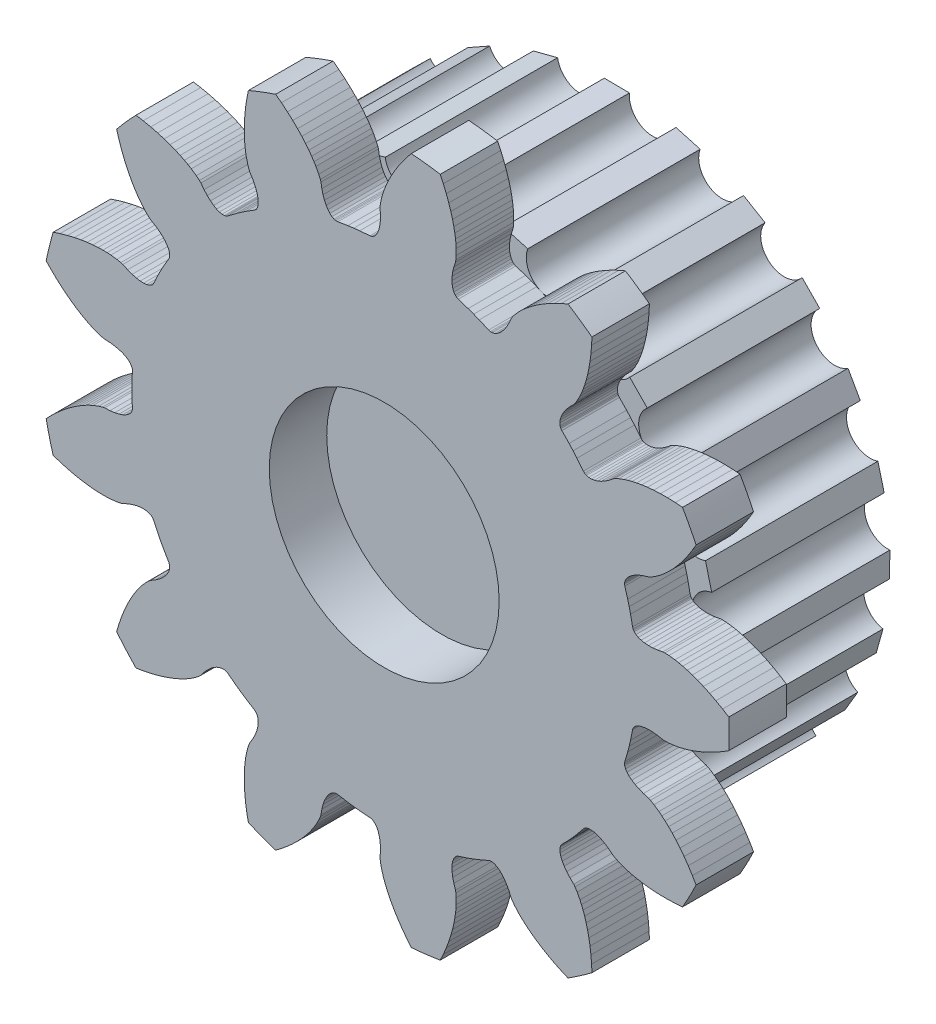
from build123d import *

# Parameters (mm, degrees)
MODEL_R             = 0.75
BOSS_EXTRUDE2_DEPTH = 5
SKETCH3_R           = 10
CUT_EXTRUDE1_DEPTH  = 5
BOSS_EXTRUDE3_DEPTH = 15


with BuildPart() as part:
    # Model → Boss-Extrude2 (new body)
    with BuildSketch(Plane.XY):
        with BuildLine():
            Line((55.1190207, -17.6838158), (54.9037463, -18.318159))
            Line((54.9037463, -18.318159), (54.724323631, -18.92713208))
            ThreePointArc((54.724323631, -18.92713208), (55.544759511, -19.893607211), (56.405295338, -20.824556888))
            Line((56.405295338, -20.824556888), (57.0314552, -20.719846))
            Line((57.0314552, -20.719846), (57.6871218, -20.5826028))
            Line((57.6871218, -20.5826028), (58.2944208, -20.4286814))
            Line((58.2944208, -20.4286814), (58.8525218, -20.2621016))
            Line((58.8525218, -20.2621016), (59.3647711, -20.0855498))
            Line((59.3647711, -20.0855498), (59.8292544, -19.9033306))
            Line((59.8292544, -19.9033306), (60.2448825, -19.7198564))
            Line((60.2448825, -19.7198564), (60.6155171, -19.5373309))
            Line((60.6155171, -19.5373309), (60.9397625, -19.3604166))
            Line((60.9397625, -19.3604166), (61.2189808, -19.1925447))
            Line((61.2189808, -19.1925447), (61.6494891, -18.8966781))
            Line((61.6494891, -18.8966781), (61.9241145, -18.6724392))
            Line((61.9241145, -18.6724392), (62.0542121, -18.5453089))
            Line((62.0542121, -18.5453089), (62.333578, -18.1781789))
            Line((62.333578, -18.1781789), (62.6138773, -17.866433))
            Line((62.6138773, -17.866433), (62.8909988, -17.6094085))
            Line((62.8909988, -17.6094085), (63.1608873, -17.4062382))
            Line((63.1608873, -17.4062382), (63.4195308, -17.2557811))
            Line((63.4195308, -17.2557811), (63.6630345, -17.1566733))
            Line((63.6630345, -17.1566733), (63.887594, -17.1072973))
            Line((63.887594, -17.1072973), (64.0894991, -17.1058455))
            Line((64.0894991, -17.1058455), (64.180835, -17.1224493))
            Line((64.180835, -17.1224493), (64.2651801, -17.1502548))
            Line((64.2651801, -17.1502548), (64.3946808, -17.2249523))
            Line((64.3946808, -17.2249523), (65.1083043, -17.7654177))
            Line((65.1083043, -17.7654177), (65.5309788, -18.0644959))
            Line((65.5309788, -18.0644959), (65.9605041, -18.3536488))
            Line((65.9605041, -18.3536488), (66.7189025, -18.8292467))
            Line((66.7189025, -18.8292467), (66.8346674, -18.9238439))
            Line((66.8346674, -18.9238439), (66.8905752, -18.9928479))
            Line((66.8905752, -18.9928479), (66.9384882, -19.0723607))
            Line((66.9384882, -19.0723607), (67.0087273, -19.2616601))
            Line((67.0087273, -19.2616601), (67.0421898, -19.4891358))
            Line((67.0421898, -19.4891358), (67.03587, -19.7519599))
            Line((67.03587, -19.7519599), (66.9869064, -20.0471485))
            Line((66.9869064, -20.0471485), (66.8926427, -20.3715438))
            Line((66.8926427, -20.3715438), (66.7505892, -20.7217991))
            Line((66.7505892, -20.7217991), (66.5584973, -21.0944301))
            Line((66.5584973, -21.0944301), (66.3142893, -21.4858279))
            Line((66.3142893, -21.4858279), (66.2415537, -21.6525523))
            Line((66.2415537, -21.6525523), (66.1292701, -21.9888476))
            Line((66.1292701, -21.9888476), (66.0052904, -22.4962956))
            Line((66.0052904, -22.4962956), (65.9473396, -22.8168975))
            Line((65.9473396, -22.8168975), (65.8969008, -23.1828069))
            Line((65.8969008, -23.1828069), (65.8576654, -23.5940807))
            Line((65.8576654, -23.5940807), (65.8334978, -24.0477606))
            Line((65.8334978, -24.0477606), (65.827828, -24.5466758))
            Line((65.827828, -24.5466758), (65.8443953, -25.0882433))
            Line((65.8443953, -25.0882433), (65.8865458, -25.6691468))
            Line((65.8865458, -25.6691468), (65.957978, -26.2915626))
            Line((65.957978, -26.2915626), (66.0621559, -26.9532886))
            Line((66.0621559, -26.9532886), (66.186288926, -27.575889293))
            ThreePointArc((66.186288926, -27.575889293), (67.36189219, -28.050384933), (68.55649269, -28.474788973))
            Line((68.55649269, -28.474788973), (69.0622682, -28.0910811))
            Line((69.0622682, -28.0910811), (69.579052, -27.6648548))
            Line((69.579052, -27.6648548), (70.0452578, -27.2463383))
            Line((70.0452578, -27.2463383), (70.4620182, -26.8394767))
            Line((70.4620182, -26.8394767), (70.8335447, -26.4450938))
            Line((70.8335447, -26.4450938), (71.1601427, -26.0678906))
            Line((71.1601427, -26.0678906), (71.4428984, -25.7122802))
            Line((71.4428984, -25.7122802), (71.6862553, -25.3784194))
            Line((71.6862553, -25.3784194), (71.8911442, -25.0710852))
            Line((71.8911442, -25.0710852), (72.0603657, -24.7926828))
            Line((72.0603657, -24.7926828), (72.3040658, -24.3306388))
            Line((72.3040658, -24.3306388), (72.4430254, -24.0044603))
            Line((72.4430254, -24.0044603), (72.4991408, -23.8314327))
            Line((72.4991408, -23.8314327), (72.5758931, -23.3765274))
            Line((72.5758931, -23.3765274), (72.6792104, -22.9702285))
            Line((72.6792104, -22.9702285), (72.8051441, -22.6138598))
            Line((72.8051441, -22.6138598), (72.9497005, -22.308538))
            Line((72.9497005, -22.308538), (73.108797, -22.0551173))
            Line((73.108797, -22.0551173), (73.2783512, -21.8541998))
            Line((73.2783512, -21.8541998), (73.4542425, -21.7061215))
            Line((73.4542425, -21.7061215), (73.632346, -21.611006))
            Line((73.632346, -21.611006), (73.720936, -21.5832621))
            Line((73.720936, -21.5832621), (73.8085418, -21.5686855))
            Line((73.8085418, -21.5686855), (73.9579226, -21.5746449))
            Line((73.9579226, -21.5746449), (74.8409717, -21.7215659))
            Line((74.8409717, -21.7215659), (75.3542199, -21.7899598))
            Line((75.3542199, -21.7899598), (75.8689217, -21.8463816))
            Line((75.8689217, -21.8463816), (76.7614715, -21.9150573))
            Line((76.7614715, -21.9150573), (76.9079377, -21.9450203))
            Line((76.9079377, -21.9450203), (76.9895094, -21.9801388))
            Line((76.9895094, -21.9801388), (77.0688857, -22.0282775))
            Line((77.0688857, -22.0282775), (77.2190512, -22.1632521))
            Line((77.2190512, -22.1632521), (77.3543939, -22.349121))
            Line((77.3543939, -22.349121), (77.4709385, -22.5847771))
            Line((77.4709385, -22.5847771), (77.5647644, -22.8689082))
            Line((77.5647644, -22.8689082), (77.632052, -23.1999525))
            Line((77.632052, -23.1999525), (77.6690417, -23.5761037))
            Line((77.6690417, -23.5761037), (77.672123, -23.9953217))
            Line((77.672123, -23.9953217), (77.6377791, -24.4553763))
            Line((77.6377791, -24.4553763), (77.6508556, -24.6368053))
            Line((77.6508556, -24.6368053), (77.7077177, -24.9867609))
            Line((77.7077177, -24.9867609), (77.833762, -25.4937))
            Line((77.833762, -25.4937), (77.9314402, -25.80451))
            Line((77.9314402, -25.80451), (78.0568255, -26.1519467))
            Line((78.0568255, -26.1519467), (78.2132127, -26.5343452))
            Line((78.2132127, -26.5343452), (78.4026489, -26.94729))
            Line((78.4026489, -26.94729), (78.629486, -27.3916924))
            Line((78.629486, -27.3916924), (78.8958345, -27.8635274))
            Line((78.8958345, -27.8635274), (79.2031163, -28.3583036))
            Line((79.2031163, -28.3583036), (79.5556174, -28.8762292))
            Line((79.5556174, -28.8762292), (79.9553818, -29.4137445))
            Line((79.9553818, -29.4137445), (80.354633081, -29.907342608))
            ThreePointArc((80.354633081, -29.907342608), (81.61608725, -29.781157591), (82.871083911, -29.601790205))
            Line((82.871083911, -29.601790205), (83.1406078, -29.0269881))
            Line((83.1406078, -29.0269881), (83.40012, -28.4094221))
            Line((83.40012, -28.4094221), (83.6184303, -27.8221874))
            Line((83.6184303, -27.8221874), (83.7983753, -27.2682512))
            Line((83.7983753, -27.2682512), (83.9440668, -26.7463855))
            Line((83.9440668, -26.7463855), (84.05796, -26.260611))
            Line((84.05796, -26.260611), (84.1430673, -25.8143305))
            Line((84.1430673, -25.8143305), (84.2033963, -25.4056179))
            Line((84.2033963, -25.4056179), (84.2419911, -25.0382703))
            Line((84.2419911, -25.0382703), (84.2624492, -24.713116))
            Line((84.2624492, -24.713116), (84.2635124, -24.1907433))
            Line((84.2635124, -24.1907433), (84.2349723, -23.8373488))
            Line((84.2349723, -23.8373488), (84.20425, -23.6580624))
            Line((84.20425, -23.6580624), (84.0608059, -23.2195952))
            Line((84.0608059, -23.2195952), (83.9634722, -22.8118215))
            Line((83.9634722, -22.8118215), (83.9093682, -22.4377484))
            Line((83.9093682, -22.4377484), (83.8954764, -22.1002206))
            Line((83.8954764, -22.1002206), (83.9185789, -21.8018918))
            Line((83.9185789, -21.8018918), (83.9753407, -21.5451926))
            Line((83.9753407, -21.5451926), (84.0622693, -21.332335))
            Line((84.0622693, -21.332335), (84.1757697, -21.1653456))
            Line((84.1757697, -21.1653456), (84.2413191, -21.0996097))
            Line((84.2413191, -21.0996097), (84.312116, -21.0459903))
            Line((84.312116, -21.0459903), (84.4471556, -20.9818463))
            Line((84.4471556, -20.9818463), (85.2973343, -20.7015651))
            Line((85.2973343, -20.7015651), (85.7835773, -20.5236065))
            Line((85.7835773, -20.5236065), (86.2655437, -20.3343717))
            Line((86.2655437, -20.3343717), (87.0877724, -19.9803925))
            Line((87.0877724, -19.9803925), (87.2313864, -19.9388571))
            Line((87.2313864, -19.9388571), (87.3199348, -19.9320447))
            Line((87.3199348, -19.9320447), (87.4125902, -19.9377815))
            Line((87.4125902, -19.9377815), (87.608281, -19.9875101))
            Line((87.608281, -19.9875101), (87.8144987, -20.089192))
            Line((87.8144987, -20.089192), (88.0272086, -20.2436941))
            Line((88.0272086, -20.2436941), (88.2423296, -20.4516767))
            Line((88.2423296, -20.4516767), (88.4557537, -20.7135317))
            Line((88.4557537, -20.7135317), (88.6633127, -21.0294071))
            Line((88.6633127, -21.0294071), (88.8608613, -21.3991742))
            Line((88.8608613, -21.3991742), (89.0442494, -21.8224928))
            Line((89.0442494, -21.8224928), (89.1401423, -21.9770632))
            Line((89.1401423, -21.9770632), (89.3531237, -22.2605083))
            Line((89.3531237, -22.2605083), (89.7003167, -22.6508049))
            Line((89.7003167, -22.6508049), (89.931247, -22.8806202))
            Line((89.931247, -22.8806202), (90.2037321, -23.1299907))
            Line((90.2037321, -23.1299907), (90.5199155, -23.395911))
            Line((90.5199155, -23.395911), (90.879558, -23.6735201))
            Line((90.879558, -23.6735201), (91.2869364, -23.9616024))
            Line((91.2869364, -23.9616024), (91.7420489, -24.2556132))
            Line((91.7420489, -24.2556132), (92.2440674, -24.5509148))
            Line((92.2440674, -24.5509148), (92.7968836, -24.8456997))
            Line((92.7968836, -24.8456997), (93.4006533, -25.1358661))
            Line((93.4006533, -25.1358661), (93.983559225, -25.387384246))
            ThreePointArc((93.983559225, -25.387384246), (95.041880291, -24.689425939), (96.069768437, -23.947377938))
            Line((96.069768437, -23.947377938), (96.0412962, -23.3131619))
            Line((96.0412962, -23.3131619), (95.9840855, -22.6457331))
            Line((95.9840855, -22.6457331), (95.9044882, -22.0243087))
            Line((95.9044882, -22.0243087), (95.8063946, -21.4501979))
            Line((95.8063946, -21.4501979), (95.6928749, -20.9204026))
            Line((95.6928749, -20.9204026), (95.5679716, -20.4373418))
            Line((95.5679716, -20.4373418), (95.4359335, -20.0026287))
            Line((95.4359335, -20.0026287), (95.2994139, -19.6126955))
            Line((95.2994139, -19.6126955), (95.162873, -19.2694895))
            Line((95.162873, -19.2694895), (95.0298811, -18.9720723))
            Line((95.0298811, -18.9720723), (94.7880637, -18.5090401))
            Line((94.7880637, -18.5090401), (94.5985622, -18.209388))
            Line((94.5985622, -18.209388), (94.4880404, -18.0649152))
            Line((94.4880404, -18.0649152), (94.157261, -17.7433335))
            Line((94.157261, -17.7433335), (93.8815744, -17.4275011))
            Line((93.8815744, -17.4275011), (93.6598272, -17.1214192))
            Line((93.6598272, -17.1214192), (93.4906698, -16.829009))
            Line((93.4906698, -16.829009), (93.3724857, -16.5541158))
            Line((93.3724857, -16.5541158), (93.3034516, -16.3004413))
            Line((93.3034516, -16.3004413), (93.2815032, -16.0715675))
            Line((93.2815032, -16.0715675), (93.304399, -15.8709595))
            Line((93.304399, -15.8709595), (93.3318911, -15.7822909))
            Line((93.3318911, -15.7822909), (93.3696606, -15.7019124))
            Line((93.3696606, -15.7019124), (93.459423, -15.5823596))
            Line((93.459423, -15.5823596), (94.0819656, -14.9390852))
            Line((94.0819656, -14.9390852), (94.4298109, -14.5555423))
            Line((94.4298109, -14.5555423), (94.7686292, -14.1640023))
            Line((94.7686292, -14.1640023), (95.3321742, -13.4684605))
            Line((95.3321742, -13.4684605), (95.4400356, -13.364942))
            Line((95.4400356, -13.364942), (95.5152755, -13.3177594))
            Line((95.5152755, -13.3177594), (95.5999838, -13.2797799))
            Line((95.5999838, -13.2797799), (95.7963694, -13.2328705))
            Line((95.7963694, -13.2328705), (96.02622, -13.2270712))
            Line((96.02622, -13.2270712), (96.286366, -13.2650248))
            Line((96.286366, -13.2650248), (96.5735005, -13.3492125))
            Line((96.5735005, -13.3492125), (96.8841683, -13.4818904))
            Line((96.8841683, -13.4818904), (97.2147472, -13.6651268))
            Line((97.2147472, -13.6651268), (97.5615072, -13.9007338))
            Line((97.5615072, -13.9007338), (97.9206152, -14.1903391))
            Line((97.9206152, -14.1903391), (98.0773567, -14.2826408))
            Line((98.0773567, -14.2826408), (98.3976658, -14.4346416))
            Line((98.3976658, -14.4346416), (98.8864698, -14.6188834))
            Line((98.8864698, -14.6188834), (99.1977489, -14.7150561))
            Line((99.1977489, -14.7150561), (99.5549107, -14.8092325))
            Line((99.5549107, -14.8092325), (99.9584566, -14.8977555))
            Line((99.9584566, -14.8977555), (100.4059156, -14.976432))
            Line((100.4059156, -14.976432), (100.9005097, -15.042198))
            Line((100.9005097, -15.042198), (101.4401255, -15.0910303))
            Line((101.4401255, -15.0910303), (102.0218743, -15.1192073))
            Line((102.0218743, -15.1192073), (102.6483621, -15.1233198))
            Line((102.6483621, -15.1233198), (103.3178207, -15.0996637))
            Line((103.3178207, -15.0996637), (103.950844382, -15.051482004))
            ThreePointArc((103.950844382, -15.051482004), (104.563583797, -13.941644289), (105.128886697, -12.80690997))
            Line((105.128886697, -12.80690997), (104.808941, -12.2585713))
            Line((104.808941, -12.2585713), (104.4481138, -11.6941795))
            Line((104.4481138, -11.6941795), (104.0888436, -11.1809263))
            Line((104.0888436, -11.1809263), (103.7351834, -10.7181628))
            Line((103.7351834, -10.7181628), (103.3884585, -10.3018076))
            Line((103.3884585, -10.3018076), (103.0533726, -9.932124))
            Line((103.0533726, -9.932124), (102.7344375, -9.6085658))
            Line((102.7344375, -9.6085658), (102.4323443, -9.3267409))
            Line((102.4323443, -9.3267409), (102.1519476, -9.0863008))
            Line((102.1519476, -9.0863008), (101.8959724, -8.8847554))
            Line((101.8959724, -8.8847554), (101.466672, -8.5871388))
            Line((101.466672, -8.5871388), (101.1596215, -8.4098759))
            Line((101.1596215, -8.4098759), (100.9946194, -8.3333136))
            Line((100.9946194, -8.3333136), (100.5522823, -8.202288))
            Line((100.5522823, -8.202288), (100.1613994, -8.0507502))
            Line((100.1613994, -8.0507502), (99.8228086, -7.8827792))
            Line((99.8228086, -7.8827792), (99.5371373, -7.7024742))
            Line((99.5371373, -7.7024742), (99.3047413, -7.5139912))
            Line((99.3047413, -7.5139912), (99.1257262, -7.3214554))
            Line((99.1257262, -7.3214554), (98.999929, -7.1289977))
            Line((98.999929, -7.1289977), (98.926975, -6.9407279))
            Line((98.926975, -6.9407279), (98.9101117, -6.8494395))
            Line((98.9101117, -6.8494395), (98.9062011, -6.7607155))
            Line((98.9062011, -6.7607155), (98.9301228, -6.6131421))
            Line((98.9301228, -6.6131421), (99.1824124, -5.7542409))
            Line((99.1824124, -5.7542409), (99.3121729, -5.2529788))
            Line((99.3121729, -5.2529788), (99.4302238, -4.7488306))
            Line((99.4302238, -4.7488306), (99.6059838, -3.8710665))
            Line((99.6059838, -3.8710665), (99.6533829, -3.7292798))
            Line((99.6533829, -3.7292798), (99.6980776, -3.6525359))
            Line((99.6980776, -3.6525359), (99.7554331, -3.5795409))
            Line((99.7554331, -3.5795409), (99.907524, -3.4467397))
            Line((99.907524, -3.4467397), (100.1083516, -3.3347877))
            Line((100.1083516, -3.3347877), (100.3563374, -3.2474981))
            Line((100.3563374, -3.2474981), (100.6497063, -3.1886046))
            Line((100.6497063, -3.1886046), (100.9864475, -3.1617105))
            Line((100.9864475, -3.1617105), (101.3643148, -3.1703306))
            Line((101.3643148, -3.1703306), (101.7808476, -3.2178028))
            Line((101.7808476, -3.2178028), (102.2334082, -3.3073498))
            Line((102.2334082, -3.3073498), (102.4150906, -3.3162375))
            Line((102.4150906, -3.3162375), (102.7693485, -3.3019724))
            Line((102.7693485, -3.3019724), (103.2877844, -3.2379519))
            Line((103.2877844, -3.2379519), (103.608102, -3.1784499))
            Line((103.608102, -3.1784499), (103.9681191, -3.0958577))
            Line((103.9681191, -3.0958577), (104.3665799, -2.9867038))
            Line((104.3665799, -2.9867038), (104.7993479, -2.8484238))
            Line((104.7993479, -2.8484238), (105.2678523, -2.6768073))
            Line((105.2678523, -2.6768073), (105.7683518, -2.4692742))
            Line((105.7683518, -2.4692742), (106.2965593, -2.2238715))
            Line((106.2965593, -2.2238715), (106.8531979, -1.9363696))
            Line((106.8531979, -1.9363696), (107.4349805, -1.6043102))
            Line((107.4349805, -1.6043102), (107.973104111, -1.267466597))
            ThreePointArc((107.973104111, -1.267466597), (107.9998906, 4.8e-08), (107.973104115, 1.267466692))
            Line((107.973104115, 1.267466692), (107.4349805, 1.6043102))
            Line((107.4349805, 1.6043102), (106.8531979, 1.9363696))
            Line((106.8531979, 1.9363696), (106.2965593, 2.2238715))
            Line((106.2965593, 2.2238715), (105.7683518, 2.4692742))
            Line((105.7683518, 2.4692742), (105.2678523, 2.6768073))
            Line((105.2678523, 2.6768073), (104.7993479, 2.8484238))
            Line((104.7993479, 2.8484238), (104.3665799, 2.9867038))
            Line((104.3665799, 2.9867038), (103.9681191, 3.0958577))
            Line((103.9681191, 3.0958577), (103.608102, 3.1784499))
            Line((103.608102, 3.1784499), (103.2877844, 3.2379519))
            Line((103.2877844, 3.2379519), (102.7693485, 3.3019724))
            Line((102.7693485, 3.3019724), (102.4150906, 3.3162375))
            Line((102.4150906, 3.3162375), (102.2334082, 3.3073498))
            Line((102.2334082, 3.3073498), (101.7808476, 3.2178028))
            Line((101.7808476, 3.2178028), (101.3643148, 3.1703306))
            Line((101.3643148, 3.1703306), (100.9864475, 3.1617105))
            Line((100.9864475, 3.1617105), (100.6497063, 3.1886046))
            Line((100.6497063, 3.1886046), (100.3563374, 3.2474981))
            Line((100.3563374, 3.2474981), (100.1083516, 3.3347877))
            Line((100.1083516, 3.3347877), (99.907524, 3.4467397))
            Line((99.907524, 3.4467397), (99.7554331, 3.5795409))
            Line((99.7554331, 3.5795409), (99.6980776, 3.6525359))
            Line((99.6980776, 3.6525359), (99.6533829, 3.7292798))
            Line((99.6533829, 3.7292798), (99.6059838, 3.8710665))
            Line((99.6059838, 3.8710665), (99.4302238, 4.7488306))
            Line((99.4302238, 4.7488306), (99.3121729, 5.2529788))
            Line((99.3121729, 5.2529788), (99.1824124, 5.7542409))
            Line((99.1824124, 5.7542409), (98.9301228, 6.6131421))
            Line((98.9301228, 6.6131421), (98.9062011, 6.7607155))
            Line((98.9062011, 6.7607155), (98.9101117, 6.8494395))
            Line((98.9101117, 6.8494395), (98.926975, 6.9407279))
            Line((98.926975, 6.9407279), (98.999929, 7.1289977))
            Line((98.999929, 7.1289977), (99.1257262, 7.3214554))
            Line((99.1257262, 7.3214554), (99.3047413, 7.5139912))
            Line((99.3047413, 7.5139912), (99.5371373, 7.7024742))
            Line((99.5371373, 7.7024742), (99.8228086, 7.8827792))
            Line((99.8228086, 7.8827792), (100.1613994, 8.0507502))
            Line((100.1613994, 8.0507502), (100.5522823, 8.202288))
            Line((100.5522823, 8.202288), (100.9946194, 8.3333136))
            Line((100.9946194, 8.3333136), (101.1596215, 8.4098759))
            Line((101.1596215, 8.4098759), (101.466672, 8.5871388))
            Line((101.466672, 8.5871388), (101.8959724, 8.8847554))
            Line((101.8959724, 8.8847554), (102.1519476, 9.0863008))
            Line((102.1519476, 9.0863008), (102.4323443, 9.3267409))
            Line((102.4323443, 9.3267409), (102.7344375, 9.6085658))
            Line((102.7344375, 9.6085658), (103.0533726, 9.932124))
            Line((103.0533726, 9.932124), (103.3884585, 10.3018076))
            Line((103.3884585, 10.3018076), (103.7351834, 10.7181628))
            Line((103.7351834, 10.7181628), (104.0888436, 11.1809263))
            Line((104.0888436, 11.1809263), (104.4481138, 11.6941795))
            Line((104.4481138, 11.6941795), (104.808941, 12.2585713))
            Line((104.808941, 12.2585713), (105.128886797, 12.80690997))
            ThreePointArc((105.128886797, 12.80690997), (104.563583897, 13.941644289), (103.950844482, 15.051482004))
            Line((103.950844482, 15.051482004), (103.3178207, 15.0996637))
            Line((103.3178207, 15.0996637), (102.6483621, 15.1233198))
            Line((102.6483621, 15.1233198), (102.0218743, 15.1192073))
            Line((102.0218743, 15.1192073), (101.4401255, 15.0910303))
            Line((101.4401255, 15.0910303), (100.9005097, 15.042198))
            Line((100.9005097, 15.042198), (100.4059156, 14.976432))
            Line((100.4059156, 14.976432), (99.9584566, 14.8977555))
            Line((99.9584566, 14.8977555), (99.5549107, 14.8092325))
            Line((99.5549107, 14.8092325), (99.1977489, 14.7150561))
            Line((99.1977489, 14.7150561), (98.8864698, 14.6188834))
            Line((98.8864698, 14.6188834), (98.3976658, 14.4346416))
            Line((98.3976658, 14.4346416), (98.0773567, 14.2826408))
            Line((98.0773567, 14.2826408), (97.9206152, 14.1903391))
            Line((97.9206152, 14.1903391), (97.5615072, 13.9007338))
            Line((97.5615072, 13.9007338), (97.2147472, 13.6651268))
            Line((97.2147472, 13.6651268), (96.8841683, 13.4818904))
            Line((96.8841683, 13.4818904), (96.5735005, 13.3492125))
            Line((96.5735005, 13.3492125), (96.286366, 13.2650248))
            Line((96.286366, 13.2650248), (96.02622, 13.2270712))
            Line((96.02622, 13.2270712), (95.7963694, 13.2328705))
            Line((95.7963694, 13.2328705), (95.5999838, 13.2797799))
            Line((95.5999838, 13.2797799), (95.5152755, 13.3177594))
            Line((95.5152755, 13.3177594), (95.4400356, 13.364942))
            Line((95.4400356, 13.364942), (95.3321742, 13.4684605))
            Line((95.3321742, 13.4684605), (94.7686292, 14.1640023))
            Line((94.7686292, 14.1640023), (94.4298109, 14.5555423))
            Line((94.4298109, 14.5555423), (94.0819656, 14.9390852))
            Line((94.0819656, 14.9390852), (93.459423, 15.5823596))
            Line((93.459423, 15.5823596), (93.3696606, 15.7019124))
            Line((93.3696606, 15.7019124), (93.3318911, 15.7822909))
            Line((93.3318911, 15.7822909), (93.304399, 15.8709595))
            Line((93.304399, 15.8709595), (93.2815032, 16.0715675))
            Line((93.2815032, 16.0715675), (93.3034516, 16.3004413))
            Line((93.3034516, 16.3004413), (93.3724857, 16.5541158))
            Line((93.3724857, 16.5541158), (93.4906698, 16.829009))
            Line((93.4906698, 16.829009), (93.6598272, 17.1214192))
            Line((93.6598272, 17.1214192), (93.8815744, 17.4275011))
            Line((93.8815744, 17.4275011), (94.157261, 17.7433335))
            Line((94.157261, 17.7433335), (94.4880404, 18.0649152))
            Line((94.4880404, 18.0649152), (94.5985622, 18.209388))
            Line((94.5985622, 18.209388), (94.7880637, 18.5090401))
            Line((94.7880637, 18.5090401), (95.0298811, 18.9720723))
            Line((95.0298811, 18.9720723), (95.162873, 19.2694895))
            Line((95.162873, 19.2694895), (95.2994139, 19.6126955))
            Line((95.2994139, 19.6126955), (95.4359335, 20.0026287))
            Line((95.4359335, 20.0026287), (95.5679716, 20.4373418))
            Line((95.5679716, 20.4373418), (95.6928749, 20.9204026))
            Line((95.6928749, 20.9204026), (95.8063946, 21.4501979))
            Line((95.8063946, 21.4501979), (95.9044882, 22.0243087))
            Line((95.9044882, 22.0243087), (95.9840855, 22.6457331))
            Line((95.9840855, 22.6457331), (96.0412962, 23.3131619))
            Line((96.0412962, 23.3131619), (96.069768437, 23.947377938))
            ThreePointArc((96.069768437, 23.947377938), (95.041880291, 24.689425939), (93.983559225, 25.387384246))
            Line((93.983559225, 25.387384246), (93.4006533, 25.1358661))
            Line((93.4006533, 25.1358661), (92.7968836, 24.8456997))
            Line((92.7968836, 24.8456997), (92.2440674, 24.5509148))
            Line((92.2440674, 24.5509148), (91.7420489, 24.2556132))
            Line((91.7420489, 24.2556132), (91.2869364, 23.9616024))
            Line((91.2869364, 23.9616024), (90.879558, 23.6735201))
            Line((90.879558, 23.6735201), (90.5199155, 23.395911))
            Line((90.5199155, 23.395911), (90.2037321, 23.1299907))
            Line((90.2037321, 23.1299907), (89.931247, 22.8806202))
            Line((89.931247, 22.8806202), (89.7003167, 22.6508049))
            Line((89.7003167, 22.6508049), (89.3531237, 22.2605083))
            Line((89.3531237, 22.2605083), (89.1401423, 21.9770632))
            Line((89.1401423, 21.9770632), (89.0442494, 21.8224928))
            Line((89.0442494, 21.8224928), (88.8608613, 21.3991742))
            Line((88.8608613, 21.3991742), (88.6633127, 21.0294071))
            Line((88.6633127, 21.0294071), (88.4557537, 20.7135317))
            Line((88.4557537, 20.7135317), (88.2423296, 20.4516767))
            Line((88.2423296, 20.4516767), (88.0272086, 20.2436941))
            Line((88.0272086, 20.2436941), (87.8144987, 20.089192))
            Line((87.8144987, 20.089192), (87.608281, 19.9875101))
            Line((87.608281, 19.9875101), (87.4125902, 19.9377815))
            Line((87.4125902, 19.9377815), (87.3199348, 19.9320447))
            Line((87.3199348, 19.9320447), (87.2313864, 19.9388571))
            Line((87.2313864, 19.9388571), (87.0877724, 19.9803925))
            Line((87.0877724, 19.9803925), (86.2655437, 20.3343717))
            Line((86.2655437, 20.3343717), (85.7835773, 20.5236065))
            Line((85.7835773, 20.5236065), (85.2973343, 20.7015651))
            Line((85.2973343, 20.7015651), (84.4471556, 20.9818463))
            Line((84.4471556, 20.9818463), (84.312116, 21.0459903))
            Line((84.312116, 21.0459903), (84.2413191, 21.0996097))
            Line((84.2413191, 21.0996097), (84.1757697, 21.1653456))
            Line((84.1757697, 21.1653456), (84.0622693, 21.332335))
            Line((84.0622693, 21.332335), (83.9753407, 21.5451926))
            Line((83.9753407, 21.5451926), (83.9185789, 21.8018918))
            Line((83.9185789, 21.8018918), (83.8954764, 22.1002206))
            Line((83.8954764, 22.1002206), (83.9093682, 22.4377484))
            Line((83.9093682, 22.4377484), (83.9634722, 22.8118215))
            Line((83.9634722, 22.8118215), (84.0608059, 23.2195952))
            Line((84.0608059, 23.2195952), (84.20425, 23.6580624))
            Line((84.20425, 23.6580624), (84.2349723, 23.8373488))
            Line((84.2349723, 23.8373488), (84.2635124, 24.1907433))
            Line((84.2635124, 24.1907433), (84.2624492, 24.713116))
            Line((84.2624492, 24.713116), (84.2419911, 25.0382703))
            Line((84.2419911, 25.0382703), (84.2033963, 25.4056179))
            Line((84.2033963, 25.4056179), (84.1430673, 25.8143305))
            Line((84.1430673, 25.8143305), (84.05796, 26.260611))
            Line((84.05796, 26.260611), (83.9440668, 26.7463855))
            Line((83.9440668, 26.7463855), (83.7983753, 27.2682512))
            Line((83.7983753, 27.2682512), (83.6184303, 27.8221874))
            Line((83.6184303, 27.8221874), (83.40012, 28.4094221))
            Line((83.40012, 28.4094221), (83.1406078, 29.0269881))
            Line((83.1406078, 29.0269881), (82.871083911, 29.601790205))
            ThreePointArc((82.871083911, 29.601790205), (81.61608725, 29.781157591), (80.354633081, 29.907342608))
            Line((80.354633081, 29.907342608), (79.9553818, 29.4137445))
            Line((79.9553818, 29.4137445), (79.5556174, 28.8762292))
            Line((79.5556174, 28.8762292), (79.2031163, 28.3583036))
            Line((79.2031163, 28.3583036), (78.8958345, 27.8635274))
            Line((78.8958345, 27.8635274), (78.629486, 27.3916924))
            Line((78.629486, 27.3916924), (78.4026489, 26.94729))
            Line((78.4026489, 26.94729), (78.2132127, 26.5343452))
            Line((78.2132127, 26.5343452), (78.0568255, 26.1519467))
            Line((78.0568255, 26.1519467), (77.9314402, 25.80451))
            Line((77.9314402, 25.80451), (77.833762, 25.4937))
            Line((77.833762, 25.4937), (77.7077177, 24.9867609))
            Line((77.7077177, 24.9867609), (77.6508556, 24.6368053))
            Line((77.6508556, 24.6368053), (77.6377791, 24.4553763))
            Line((77.6377791, 24.4553763), (77.672123, 23.9953217))
            Line((77.672123, 23.9953217), (77.6690417, 23.5761037))
            Line((77.6690417, 23.5761037), (77.632052, 23.1999525))
            Line((77.632052, 23.1999525), (77.5647644, 22.8689082))
            Line((77.5647644, 22.8689082), (77.4709385, 22.5847771))
            Line((77.4709385, 22.5847771), (77.3543939, 22.349121))
            Line((77.3543939, 22.349121), (77.2190512, 22.1632521))
            Line((77.2190512, 22.1632521), (77.0688857, 22.0282775))
            Line((77.0688857, 22.0282775), (76.9895094, 21.9801388))
            Line((76.9895094, 21.9801388), (76.9079377, 21.9450203))
            Line((76.9079377, 21.9450203), (76.7614715, 21.9150573))
            Line((76.7614715, 21.9150573), (75.8689217, 21.8463816))
            Line((75.8689217, 21.8463816), (75.3542199, 21.7899598))
            Line((75.3542199, 21.7899598), (74.8409717, 21.7215659))
            Line((74.8409717, 21.7215659), (73.9579226, 21.5746449))
            Line((73.9579226, 21.5746449), (73.8085418, 21.5686855))
            Line((73.8085418, 21.5686855), (73.720936, 21.5832621))
            Line((73.720936, 21.5832621), (73.632346, 21.611006))
            Line((73.632346, 21.611006), (73.4542425, 21.7061215))
            Line((73.4542425, 21.7061215), (73.2783512, 21.8541998))
            Line((73.2783512, 21.8541998), (73.108797, 22.0551173))
            Line((73.108797, 22.0551173), (72.9497005, 22.308538))
            Line((72.9497005, 22.308538), (72.8051441, 22.6138598))
            Line((72.8051441, 22.6138598), (72.6792104, 22.9702285))
            Line((72.6792104, 22.9702285), (72.5758931, 23.3765274))
            Line((72.5758931, 23.3765274), (72.4991408, 23.8314327))
            Line((72.4991408, 23.8314327), (72.4430254, 24.0044603))
            Line((72.4430254, 24.0044603), (72.3040658, 24.3306388))
            Line((72.3040658, 24.3306388), (72.0603657, 24.7926828))
            Line((72.0603657, 24.7926828), (71.8911442, 25.0710852))
            Line((71.8911442, 25.0710852), (71.6862553, 25.3784194))
            Line((71.6862553, 25.3784194), (71.4428984, 25.7122802))
            Line((71.4428984, 25.7122802), (71.1601427, 26.0678906))
            Line((71.1601427, 26.0678906), (70.8335447, 26.4450938))
            Line((70.8335447, 26.4450938), (70.4620182, 26.8394767))
            Line((70.4620182, 26.8394767), (70.0452578, 27.2463383))
            Line((70.0452578, 27.2463383), (69.579052, 27.6648548))
            Line((69.579052, 27.6648548), (69.0622682, 28.0910811))
            Line((69.0622682, 28.0910811), (68.55649274, 28.474788957))
            ThreePointArc((68.55649274, 28.474788957), (67.361892216, 28.050384905), (66.18628893, 27.575889252))
            Line((66.18628893, 27.575889252), (66.0621559, 26.9532886))
            Line((66.0621559, 26.9532886), (65.957978, 26.2915626))
            Line((65.957978, 26.2915626), (65.8865458, 25.6691468))
            Line((65.8865458, 25.6691468), (65.8443953, 25.0882433))
            Line((65.8443953, 25.0882433), (65.827828, 24.5466758))
            Line((65.827828, 24.5466758), (65.8334978, 24.0477606))
            Line((65.8334978, 24.0477606), (65.8576654, 23.5940807))
            Line((65.8576654, 23.5940807), (65.8969008, 23.1828069))
            Line((65.8969008, 23.1828069), (65.9473396, 22.8168975))
            Line((65.9473396, 22.8168975), (66.0052904, 22.4962956))
            Line((66.0052904, 22.4962956), (66.1292701, 21.9888476))
            Line((66.1292701, 21.9888476), (66.2415537, 21.6525523))
            Line((66.2415537, 21.6525523), (66.3142893, 21.4858279))
            Line((66.3142893, 21.4858279), (66.5584973, 21.0944301))
            Line((66.5584973, 21.0944301), (66.7505892, 20.7217991))
            Line((66.7505892, 20.7217991), (66.8926427, 20.3715438))
            Line((66.8926427, 20.3715438), (66.9869064, 20.0471485))
            Line((66.9869064, 20.0471485), (67.03587, 19.7519599))
            Line((67.03587, 19.7519599), (67.0421898, 19.4891358))
            Line((67.0421898, 19.4891358), (67.0087273, 19.2616601))
            Line((67.0087273, 19.2616601), (66.9384882, 19.0723607))
            Line((66.9384882, 19.0723607), (66.8905752, 18.9928479))
            Line((66.8905752, 18.9928479), (66.8346674, 18.9238439))
            Line((66.8346674, 18.9238439), (66.7189025, 18.8292467))
            Line((66.7189025, 18.8292467), (65.9605041, 18.3536488))
            Line((65.9605041, 18.3536488), (65.5309788, 18.0644959))
            Line((65.5309788, 18.0644959), (65.1083043, 17.7654177))
            Line((65.1083043, 17.7654177), (64.3946808, 17.2249523))
            Line((64.3946808, 17.2249523), (64.2651801, 17.1502548))
            Line((64.2651801, 17.1502548), (64.180835, 17.1224493))
            Line((64.180835, 17.1224493), (64.0894991, 17.1058455))
            Line((64.0894991, 17.1058455), (63.887594, 17.1072973))
            Line((63.887594, 17.1072973), (63.6630345, 17.1566733))
            Line((63.6630345, 17.1566733), (63.4195308, 17.2557811))
            Line((63.4195308, 17.2557811), (63.1608873, 17.4062382))
            Line((63.1608873, 17.4062382), (62.8909988, 17.6094085))
            Line((62.8909988, 17.6094085), (62.6138773, 17.866433))
            Line((62.6138773, 17.866433), (62.333578, 18.1781789))
            Line((62.333578, 18.1781789), (62.0542121, 18.5453089))
            Line((62.0542121, 18.5453089), (61.9241145, 18.6724392))
            Line((61.9241145, 18.6724392), (61.6494891, 18.8966781))
            Line((61.6494891, 18.8966781), (61.2189808, 19.1925447))
            Line((61.2189808, 19.1925447), (60.9397625, 19.3604166))
            Line((60.9397625, 19.3604166), (60.6155171, 19.5373309))
            Line((60.6155171, 19.5373309), (60.2448825, 19.7198564))
            Line((60.2448825, 19.7198564), (59.8292544, 19.9033306))
            Line((59.8292544, 19.9033306), (59.3647711, 20.0855498))
            Line((59.3647711, 20.0855498), (58.8525218, 20.2621016))
            Line((58.8525218, 20.2621016), (58.2944208, 20.4286814))
            Line((58.2944208, 20.4286814), (57.6871218, 20.5826028))
            Line((57.6871218, 20.5826028), (57.0314552, 20.719846))
            Line((57.0314552, 20.719846), (56.405295338, 20.824556788))
            ThreePointArc((56.405295338, 20.824556788), (55.544759511, 19.893607111), (54.724323631, 18.92713198))
            Line((54.724323631, 18.92713198), (54.9037463, 18.318159))
            Line((54.9037463, 18.318159), (55.1190207, 17.6838158))
            Line((55.1190207, 17.6838158), (55.3450216, 17.0994979))
            Line((55.3450216, 17.0994979), (55.5776585, 16.565545))
            Line((55.5776585, 16.565545), (55.8146679, 16.0783116))
            Line((55.8146679, 16.0783116), (56.0515457, 15.639179))
            Line((56.0515457, 15.639179), (56.2837806, 15.2486967))
            Line((56.2837806, 15.2486967), (56.5096504, 14.9027654))
            Line((56.5096504, 14.9027654), (56.7243582, 14.6022088))
            Line((56.7243582, 14.6022088), (56.9246623, 14.345261))
            Line((56.9246623, 14.345261), (57.2702637, 13.9535544))
            Line((57.2702637, 13.9535544), (57.5259701, 13.7079604))
            Line((57.5259701, 13.7079604), (57.6678549, 13.5941352))
            Line((57.6678549, 13.5941352), (58.065982, 13.3610589))
            Line((58.065982, 13.3610589), (58.4092413, 13.12038))
            Line((58.4092413, 13.12038), (58.6977951, 12.8762599))
            Line((58.6977951, 12.8762599), (58.9320155, 12.6328287))
            Line((58.9320155, 12.6328287), (59.1125516, 12.3942066))
            Line((59.1125516, 12.3942066), (59.2402879, 12.1644244))
            Line((59.2402879, 12.1644244), (59.3163716, 11.9474539))
            Line((59.3163716, 11.9474539), (59.3421498, 11.7471958))
            Line((59.3421498, 11.7471958), (59.3366763, 11.6545245))
            Line((59.3366763, 11.6545245), (59.3192402, 11.5674428))
            Line((59.3192402, 11.5674428), (59.260697, 11.4298825))
            Line((59.260697, 11.4298825), (58.81019, 10.6563162))
            Line((58.81019, 10.6563162), (58.5642402, 10.2006736))
            Line((58.5642402, 10.2006736), (58.3289691, 9.7394265))
            Line((58.3289691, 9.7394265), (57.9482537, 8.9292307))
            Line((57.9482537, 8.9292307), (57.8683001, 8.8029074))
            Line((57.8683001, 8.8029074), (57.8065381, 8.7390897))
            Line((57.8065381, 8.7390897), (57.7333804, 8.6819419))
            Line((57.7333804, 8.6819419), (57.5539276, 8.5893973))
            Line((57.5539276, 8.5893973), (57.3321439, 8.5287597))
            Line((57.3321439, 8.5287597), (57.0704743, 8.5033535))
            Line((57.0704743, 8.5033535), (56.771536, 8.516379))
            Line((56.771536, 8.516379), (56.4381437, 8.5708539))
            Line((56.4381437, 8.5708539), (56.0733195, 8.669653))
            Line((56.0733195, 8.669653), (55.6802512, 8.8154287))
            Line((55.6802512, 8.8154287), (55.2622712, 9.0106784))
            Line((55.2622712, 9.0106784), (55.0879951, 9.0627872))
            Line((55.0879951, 9.0627872), (54.7406174, 9.1337162))
            Line((54.7406174, 9.1337162), (54.2219252, 9.1956259))
            Line((54.2219252, 9.1956259), (53.8966757, 9.2145099))
            Line((53.8966757, 9.2145099), (53.5273545, 9.2204754))
            Line((53.5273545, 9.2204754), (53.11435, 9.2098512))
            Line((53.11435, 9.2098512), (52.6610649, 9.1791575))
            Line((52.6610649, 9.1791575), (52.1651039, 9.1246484))
            Line((52.1651039, 9.1246484), (51.629482, 9.0429231))
            Line((51.629482, 9.0429231), (51.0578946, 8.9310598))
            Line((51.0578946, 8.9310598), (50.4486272, 8.7851245))
            Line((50.4486272, 8.7851245), (49.8042831, 8.6019438))
            Line((49.8042831, 8.6019438), (49.201184451, 8.403669694))
            ThreePointArc((49.201184451, 8.403669694), (48.871851727, 7.179443721), (48.594535246, 5.942396896))
            Line((48.594535246, 5.942396896), (49.03641, 5.48656))
            Line((49.03641, 5.48656), (49.52182, 5.02492))
            Line((49.52182, 5.02492), (49.99348, 4.61256))
            Line((49.99348, 4.61256), (50.44761, 4.24788))
            Line((50.44761, 4.24788), (50.8839, 3.9266))
            Line((50.8839, 3.9266), (51.29772, 3.64785))
            Line((51.29772, 3.64785), (51.68482, 3.41002))
            Line((51.68482, 3.41002), (52.04558, 3.20868))
            Line((52.04558, 3.20868), (52.37537, 3.04233))
            Line((52.37537, 3.04233), (52.67214, 2.9079))
            Line((52.67214, 2.9079), (53.16019, 2.72167))
            Line((53.16019, 2.72167), (53.50074, 2.62304))
            Line((53.50074, 2.62304), (53.67927, 2.58819))
            Line((53.67927, 2.58819), (54.14011, 2.56683))
            Line((54.14011, 2.56683), (54.5559, 2.51324))
            Line((54.5559, 2.51324), (54.92485, 2.43118))
            Line((54.92485, 2.43118), (55.24537, 2.32448))
            Line((55.24537, 2.32448), (55.51612, 2.19709))
            Line((55.51612, 2.19709), (55.73601, 2.05299))
            Line((55.73601, 2.05299), (55.90421, 1.89623))
            Line((55.90421, 1.89623), (56.0201, 1.73089))
            Line((56.0201, 1.73089), (56.05832, 1.64629))
            Line((56.05832, 1.64629), (56.08335, 1.56108))
            Line((56.08335, 1.56108), (56.09544, 1.41207))
            Line((56.09544, 1.41207), (56.05603, 0.51775))
            Line((56.05603, 0.51775), (56.05, 0))
            Line((56.05, 0), (56.05603, -0.51775))
            Line((56.05603, -0.51775), (56.09544, -1.41207))
            Line((56.09544, -1.41207), (56.08335, -1.56108))
            Line((56.08335, -1.56108), (56.05832, -1.64629))
            Line((56.05832, -1.64629), (56.0201, -1.73089))
            Line((56.0201, -1.73089), (55.90421, -1.89623))
            Line((55.90421, -1.89623), (55.73601, -2.05299))
            Line((55.73601, -2.05299), (55.51612, -2.19709))
            Line((55.51612, -2.19709), (55.24537, -2.32448))
            Line((55.24537, -2.32448), (54.92485, -2.43118))
            Line((54.92485, -2.43118), (54.5559, -2.51324))
            Line((54.5559, -2.51324), (54.14011, -2.56683))
            Line((54.14011, -2.56683), (53.67927, -2.58819))
            Line((53.67927, -2.58819), (53.50074, -2.62304))
            Line((53.50074, -2.62304), (53.16019, -2.72167))
            Line((53.16019, -2.72167), (52.67214, -2.9079))
            Line((52.67214, -2.9079), (52.37537, -3.04233))
            Line((52.37537, -3.04233), (52.04558, -3.20868))
            Line((52.04558, -3.20868), (51.68482, -3.41002))
            Line((51.68482, -3.41002), (51.29772, -3.64785))
            Line((51.29772, -3.64785), (50.8839, -3.9266))
            Line((50.8839, -3.9266), (50.44761, -4.24788))
            Line((50.44761, -4.24788), (49.99348, -4.61256))
            Line((49.99348, -4.61256), (49.52182, -5.02492))
            Line((49.52182, -5.02492), (49.03641, -5.48656))
            Line((49.03641, -5.48656), (48.594535325, -5.942396893))
            ThreePointArc((48.594535325, -5.942396893), (48.871851802, -7.179443719), (49.201184522, -8.403669694))
            Line((49.201184522, -8.403669694), (49.8042831, -8.6019438))
            Line((49.8042831, -8.6019438), (50.4486272, -8.7851245))
            Line((50.4486272, -8.7851245), (51.0578946, -8.9310598))
            Line((51.0578946, -8.9310598), (51.629482, -9.0429231))
            Line((51.629482, -9.0429231), (52.1651039, -9.1246484))
            Line((52.1651039, -9.1246484), (52.6610649, -9.1791575))
            Line((52.6610649, -9.1791575), (53.11435, -9.2098512))
            Line((53.11435, -9.2098512), (53.5273545, -9.2204754))
            Line((53.5273545, -9.2204754), (53.8966757, -9.2145099))
            Line((53.8966757, -9.2145099), (54.2219252, -9.1956259))
            Line((54.2219252, -9.1956259), (54.7406174, -9.1337162))
            Line((54.7406174, -9.1337162), (55.0879951, -9.0627872))
            Line((55.0879951, -9.0627872), (55.2622712, -9.0106784))
            Line((55.2622712, -9.0106784), (55.6802512, -8.8154287))
            Line((55.6802512, -8.8154287), (56.0733195, -8.669653))
            Line((56.0733195, -8.669653), (56.4381437, -8.5708539))
            Line((56.4381437, -8.5708539), (56.771536, -8.516379))
            Line((56.771536, -8.516379), (57.0704743, -8.5033535))
            Line((57.0704743, -8.5033535), (57.3321439, -8.5287597))
            Line((57.3321439, -8.5287597), (57.5539276, -8.5893973))
            Line((57.5539276, -8.5893973), (57.7333804, -8.6819419))
            Line((57.7333804, -8.6819419), (57.8065381, -8.7390897))
            Line((57.8065381, -8.7390897), (57.8683001, -8.8029074))
            Line((57.8683001, -8.8029074), (57.9482537, -8.9292307))
            Line((57.9482537, -8.9292307), (58.3289691, -9.7394265))
            Line((58.3289691, -9.7394265), (58.5642402, -10.2006736))
            Line((58.5642402, -10.2006736), (58.81019, -10.6563162))
            Line((58.81019, -10.6563162), (59.260697, -11.4298825))
            Line((59.260697, -11.4298825), (59.3192402, -11.5674428))
            Line((59.3192402, -11.5674428), (59.3366763, -11.6545245))
            Line((59.3366763, -11.6545245), (59.3421498, -11.7471958))
            Line((59.3421498, -11.7471958), (59.3163716, -11.9474539))
            Line((59.3163716, -11.9474539), (59.2402879, -12.1644244))
            Line((59.2402879, -12.1644244), (59.1125516, -12.3942066))
            Line((59.1125516, -12.3942066), (58.9320155, -12.6328287))
            Line((58.9320155, -12.6328287), (58.6977951, -12.8762599))
            Line((58.6977951, -12.8762599), (58.4092413, -13.12038))
            Line((58.4092413, -13.12038), (58.065982, -13.3610589))
            Line((58.065982, -13.3610589), (57.6678549, -13.5941352))
            Line((57.6678549, -13.5941352), (57.5259701, -13.7079604))
            Line((57.5259701, -13.7079604), (57.2702637, -13.9535544))
            Line((57.2702637, -13.9535544), (56.9246623, -14.345261))
            Line((56.9246623, -14.345261), (56.7243582, -14.6022088))
            Line((56.7243582, -14.6022088), (56.5096504, -14.9027654))
            Line((56.5096504, -14.9027654), (56.2837806, -15.2486967))
            Line((56.2837806, -15.2486967), (56.0515457, -15.639179))
            Line((56.0515457, -15.639179), (55.8146679, -16.0783116))
            Line((55.8146679, -16.0783116), (55.5776585, -16.565545))
            Line((55.5776585, -16.565545), (55.3450216, -17.0994979))
            Line((55.3450216, -17.0994979), (55.1190207, -17.6838158))
        make_face()
        with Locations((78, 0)):
            Circle(MODEL_R, mode=Mode.SUBTRACT)
    extrude(amount=BOSS_EXTRUDE2_DEPTH)

    # Sketch3 → Cut-Extrude1 (cut)
    with BuildSketch(Plane(origin=(0, 0, 0), x_dir=(-1, 0, 0), z_dir=(0, 0, -1))):
        with Locations((-78, 0)):
            Circle(SKETCH3_R)
    extrude(amount=-CUT_EXTRUDE1_DEPTH, mode=Mode.SUBTRACT)

    # Sketch4 → Boss-Extrude3 (add)
    with BuildSketch(Plane(origin=(0, 0, 0), x_dir=(-1, 0, 0), z_dir=(0, 0, -1))):
        with BuildLine():
            Line((-77.150869312, 23.984973985), (-79.331945279, 23.963011534))
            ThreePointArc((-79.331945279, 23.963011534), (-79.324532312, 23.862591133), (-79.322059335, 23.761927866))
            ThreePointArc((-79.322059335, 23.761927866), (-81.184041439, 21.720568212), (-83.387570803, 23.387477009))
            Line((-83.387570803, 23.387477009), (-85.488644108, 22.801758911))
            ThreePointArc((-85.488644108, 22.801758911), (-85.390327728, 22.446564617), (-85.357198679, 22.079506634))
            ThreePointArc((-85.357198679, 22.079506634), (-86.9543384, 20.080152354), (-89.257118246, 21.196162124))
            Line((-89.257118246, 21.196162124), (-91.135004215, 20.0866041))
            ThreePointArc((-91.135004215, 20.0866041), (-90.849547321, 19.519575748), (-90.751252981, 18.892403512))
            ThreePointArc((-90.751252981, 18.892403512), (-92.091298883, 16.969264112), (-94.359511684, 17.560363819))
            Line((-94.359511684, 17.560363819), (-95.886235492, 16.002580414))
            ThreePointArc((-95.886235492, 16.002580414), (-95.333480209, 15.29436971), (-95.136626353, 14.417814313))
            ThreePointArc((-95.136626353, 14.417814313), (-96.231725948, 12.60379524), (-98.347031437, 12.727855739))
            Line((-98.347031437, 12.727855739), (-99.418549379, 10.828007319))
            ThreePointArc((-99.418549379, 10.828007319), (-98.541584063, 10.071615347), (-98.214462847, 8.960674895))
            ThreePointArc((-98.214462847, 8.960674895), (-99.080954745, 7.286814519), (-100.947934622, 7.027965325))
            Line((-100.947934622, 7.027965325), (-101.491224522, 4.915523418))
            ThreePointArc((-101.491224522, 4.915523418), (-100.261880502, 4.2191973), (-99.775012992, 2.89288029))
            ThreePointArc((-99.775012992, 2.89288029), (-100.433147345, 1.387818827), (-101.984973985, 0.849130688))
            Line((-101.984973985, 0.849130688), (-101.963011534, -1.331945279))
            ThreePointArc((-101.963011534, -1.331945279), (-100.38528731, -1.853059411), (-99.711927876, -3.372059325))
            ThreePointArc((-99.711927876, -3.372059325), (-100.18551989, -4.682569857), (-101.387477009, -5.387570803))
            Line((-101.387477009, -5.387570803), (-100.801758911, -7.488644108))
            ThreePointArc((-100.801758911, -7.488644108), (-98.912912703, -7.721506361), (-98.029506643, -9.40719867))
            ThreePointArc((-98.029506643, -9.40719867), (-98.345529097, -10.500735072), (-99.196162124, -11.257118246))
            Line((-99.196162124, -11.257118246), (-98.0866041, -13.135004215))
            ThreePointArc((-98.0866041, -13.135004215), (-95.955816953, -12.97771093), (-94.842403522, -14.801252971))
            ThreePointArc((-94.842403522, -14.801252971), (-95.030525251, -15.659104533), (-95.560363819, -16.359511684))
            Line((-95.560363819, -16.359511684), (-94.002580414, -17.886235492))
            ThreePointArc((-94.002580414, -17.886235492), (-91.72726038, -17.25643588), (-90.367814322, -19.186626343))
            ThreePointArc((-90.367814322, -19.186626343), (-90.459892581, -19.794114986), (-90.727855739, -20.347031437))
            Line((-90.727855739, -20.347031437), (-88.828007319, -21.418549379))
            ThreePointArc((-88.828007319, -21.418549379), (-86.527969158, -20.260650045), (-84.910674904, -22.264462837))
            ThreePointArc((-84.910674904, -22.264462837), (-84.940210275, -22.611194262), (-85.027965325, -22.947934622))
            Line((-85.027965325, -22.947934622), (-82.915523418, -23.491224522))
            ThreePointArc((-82.915523418, -23.491224522), (-80.725426465, -21.781863655), (-78.8428803, -23.825012983))
            ThreePointArc((-78.8428803, -23.825012983), (-78.844443493, -23.905054518), (-78.849130688, -23.984973985))
            Line((-78.849130688, -23.984973985), (-76.668054721, -23.963011534))
            ThreePointArc((-76.668054721, -23.963011534), (-74.915970741, -21.732263204), (-72.612429197, -23.387477009))
            Line((-72.612429197, -23.387477009), (-70.511355892, -22.801758911))
            ThreePointArc((-70.511355892, -22.801758911), (-69.396332879, -20.193548784), (-66.742881754, -21.196162124))
            Line((-66.742881754, -21.196162124), (-64.864995785, -20.0866041))
            ThreePointArc((-64.864995785, -20.0866041), (-64.463020714, -17.278677387), (-61.640488316, -17.560363819))
            Line((-61.640488316, -17.560363819), (-60.113764508, -16.002580414))
            ThreePointArc((-60.113764508, -16.002580414), (-60.452231316, -13.186292679), (-57.652968563, -12.727855739))
            Line((-57.652968563, -12.727855739), (-56.581450621, -10.828007319))
            ThreePointArc((-56.581450621, -10.828007319), (-57.637293354, -8.195283918), (-55.052065378, -7.027965325))
            Line((-55.052065378, -7.027965325), (-54.508775478, -4.915523418))
            ThreePointArc((-54.508775478, -4.915523418), (-56.2100402, -2.6457801), (-54.015026015, -0.849130688))
            Line((-54.015026015, -0.849130688), (-54.036988466, 1.331945279))
            ThreePointArc((-54.036988466, 1.331945279), (-56.267736796, 3.084029259), (-54.612522991, 5.387570803))
            Line((-54.612522991, 5.387570803), (-55.198241089, 7.488644108))
            ThreePointArc((-55.198241089, 7.488644108), (-57.806451216, 8.603667121), (-56.803837876, 11.257118246))
            Line((-56.803837876, 11.257118246), (-57.9133959, 13.135004215))
            ThreePointArc((-57.9133959, 13.135004215), (-60.721322613, 13.536979286), (-60.439636181, 16.359511684))
            Line((-60.439636181, 16.359511684), (-61.997419586, 17.886235492))
            ThreePointArc((-61.997419586, 17.886235492), (-64.813707321, 17.547768684), (-65.272144261, 20.347031437))
            Line((-65.272144261, 20.347031437), (-67.171992681, 21.418549379))
            ThreePointArc((-67.171992681, 21.418549379), (-69.804716082, 20.362706646), (-70.972034675, 22.947934622))
            Line((-70.972034675, 22.947934622), (-73.084476582, 23.491224522))
            ThreePointArc((-73.084476582, 23.491224522), (-75.3542199, 21.7899598), (-77.150869312, 23.984973985))
        make_face()
    extrude(amount=BOSS_EXTRUDE3_DEPTH)


solid = part.part
